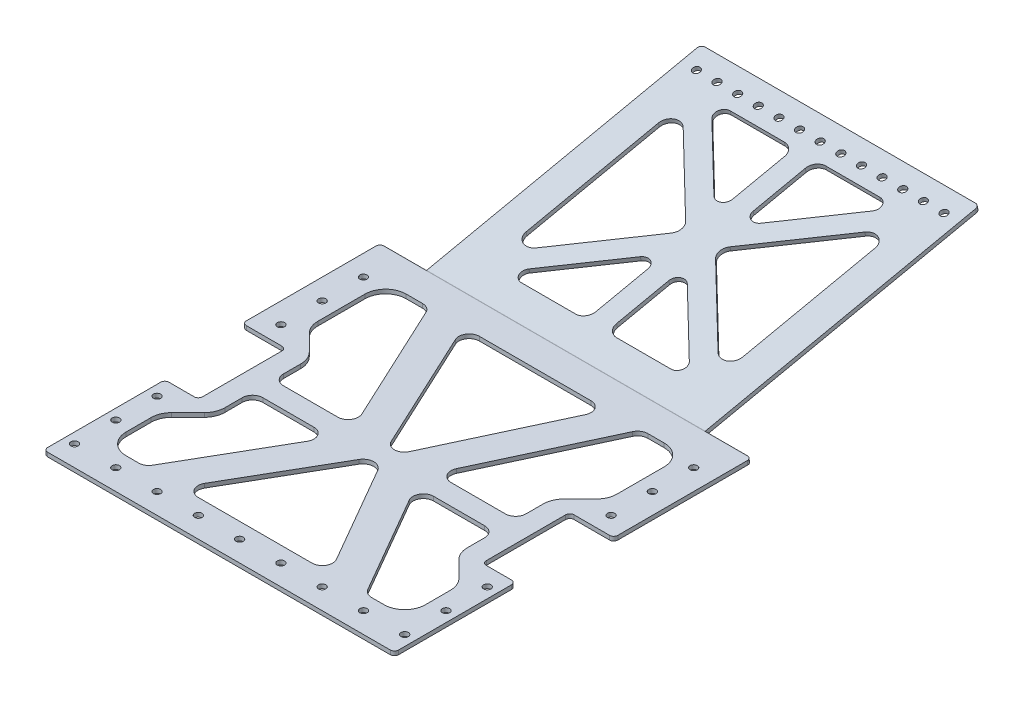
from build123d import *

# Parameters (mm, degrees)
BASE_FLANGE1_DEPTH     = 2.54
SKETCHED_START         = -114.3
SKETCHED_BEND1_DEPTH   = 228.6
SKETCHED_BEND1_2_DEPTH = 28.575
SKETCHED_START_2       = 85.725
SKETCHED_BEND1_3_DEPTH = 28.575
SKETCHED_START_3       = -85.725
SKETCHED_BEND1_4_DEPTH = 171.45
SKETCHED_BEND1_5_DEPTH = 228.6
F_8_CLEARANCE_HOLE1_D  = 4.4958
F_8_CLEARANCE_HOLE2_D  = 4.4958
FILLET1_START          = -2.54
FILLET1_DEPTH          = 2.54
FILLET1_START_2        = -4
FILLET1_2_DEPTH        = 5
FILLET1_START_3        = -26
FILLET1_3_DEPTH        = 5
FILLET1_START_4        = -48
FILLET1_4_DEPTH        = 5
CUT_EXTRUDE1_DEPTH     = 402.134031528
CUT_EXTRUDE2_DEPTH     = 399.66822503


with BuildPart() as part:
    # Base-Flange1: sheet metal written as solids
    # Sketch1 → Base-Flange1 (new body)
    with BuildSketch(Plane(origin=(0, 0, 0), x_dir=(1, 0, 0), z_dir=(0, 1, 0))):
        Polygon((-107.95, 0), (107.95, 0), (107.95, 74.6125), (87.3125, 74.6125), (87.3125, 128.5875), (114.3, 128.5875), (114.3, 213.519597452), (85.725, 213.519597452), (85.725, 386.335902568), (-85.725, 386.335902568), (-85.725, 213.519597452), (-114.3, 213.519597452), (-114.3, 128.5875), (-87.3125, 128.5875), (-87.3125, 74.6125), (-107.95, 74.6125), align=None)
    extrude(amount=-BASE_FLANGE1_DEPTH)

    # Sketched Bend1: read off the stored shape, not the designer's step
    # Sketched Bend1 outline → Sketched Bend1 (cut)
    with BuildSketch(Plane.YZ.offset(SKETCHED_START)):
        with BuildLine():
            Line((0, -386.335902568), (0, -225.603611808))
            Line((0, -225.603611808), (-2.468398429, -213.990710237))
            ThreePointArc((-2.468398429, -213.990710237), (-2.522050442, -213.651964754), (-2.54, -213.309466791))
            Line((-2.54, -213.309466791), (-2.54, -386.335902568))
            Line((-2.54, -386.335902568), (0, -386.335902568))
        make_face()
    extrude(amount=SKETCHED_BEND1_DEPTH, mode=Mode.SUBTRACT)

    # Sketched Bend1 2 outline → Sketched Bend1 2 (cut)
    with BuildSketch(Plane.YZ.offset(SKETCHED_START)):
        Polygon((0, -213.519597452), (0, -213.386886571), (-1.26265969, -213.519597452), align=None)
    extrude(amount=SKETCHED_BEND1_2_DEPTH, mode=Mode.SUBTRACT)

    # Sketched Bend1 3 outline → Sketched Bend1 3 (cut)
    with BuildSketch(Plane.YZ.offset(SKETCHED_START_2)):
        Polygon((0, -213.519597452), (0, -213.386886571), (-1.26265969, -213.519597452), align=None)
    extrude(amount=SKETCHED_BEND1_3_DEPTH, mode=Mode.SUBTRACT)

    # Sketched Bend1 4 outline → Sketched Bend1 4 (add)
    with BuildSketch(Plane.YZ.offset(SKETCHED_START_3)):
        with BuildLine():
            Line((35.902938054, -382.296929958), (0.016096477, -213.462614543))
            ThreePointArc((0.016096477, -213.462614543), (0.004035172, -213.386462457), (0, -213.309466791))
            Line((0, -213.309466791), (0, -225.603611808))
            Line((0, -225.603611808), (33.418443148, -382.825025653))
            Line((33.418443148, -382.825025653), (35.902938054, -382.296929958))
        make_face()
    extrude(amount=SKETCHED_BEND1_4_DEPTH)

    # Sketched Bend1 5 outline → Sketched Bend1 5 (add)
    with BuildSketch(Plane.YZ.offset(SKETCHED_START)):
        with BuildLine():
            Line((0, -213.386886571), (0.004035172, -213.386462457))
            ThreePointArc((0.004035172, -213.386462457), (0.001009485, -213.348017456), (0, -213.309466791))
            Line((0, -213.309466791), (0, -213.386886571))
        make_face()
        with BuildLine():
            Line((-2.522050442, -213.651964754), (-1.26265969, -213.519597452))
            Line((-1.26265969, -213.519597452), (-2.533255144, -213.519597452))
            ThreePointArc((-2.533255144, -213.519597452), (-2.52832367, -213.585837892), (-2.522050442, -213.651964754))
        make_face()
    extrude(amount=SKETCHED_BEND1_5_DEPTH)

    # #8 Clearance Hole1 (through all)
    with Locations(Plane(origin=(0, 0, 0), x_dir=(1, 0, 0), z_dir=(0, 1, 0))):
        with Locations((-101.6, 12.7), (-101.6, 38.1), (-101.6, 63.5), (-101.6, 139.7), (-101.6, 165.1), (-101.6, 190.5), (101.6, 190.5), (101.6, 165.1), (101.6, 139.7), (101.6, 63.5), (101.6, 38.1), (-76.2, 12.7), (-50.8, 12.7), (-25.4, 12.7), (0, 12.7), (25.4, 12.7), (50.8, 12.7), (76.2, 12.7), (101.6, 12.7)):
            Hole(F_8_CLEARANCE_HOLE1_D / 2)

    # #8 Clearance Hole2 (through all)
    with Locations(Plane(origin=(0, -43.39613296, -9.224132812), x_dir=(1, 0, 0), z_dir=(0, 0.9781476007338055, 0.20791169081775976))):
        with Locations((-76.2, 368.80397692), (-63.5, 368.80397692), (-50.8, 368.80397692), (-38.1, 368.80397692), (-25.4, 368.80397692), (-12.7, 368.80397692), (0, 368.80397692), (12.7, 368.80397692), (25.4, 368.80397692), (38.1, 368.80397692), (50.8, 368.80397692), (63.5, 368.80397692), (76.2, 368.80397692)):
            Hole(F_8_CLEARANCE_HOLE2_D / 2)

    # Fillet1: read off the stored shape, not the designer's step
    # Fillet1 outline → Fillet1 (add)
    with BuildSketch(Plane(origin=(0, 0, 0), x_dir=(1, 0, 0), z_dir=(0, 1, 0)).offset(FILLET1_START)):
        with BuildLine():
            Line((87.3125, 128.5875), (87.3125, 126.0475))
            ThreePointArc((87.3125, 126.0475), (88.056448776, 127.843551224), (89.8525, 128.5875))
            Line((89.8525, 128.5875), (87.3125, 128.5875))
        make_face()
        with BuildLine():
            Line((87.3125, 74.6125), (89.8525, 74.6125))
            ThreePointArc((89.8525, 74.6125), (88.056448776, 75.356448776), (87.3125, 77.1525))
            Line((87.3125, 77.1525), (87.3125, 74.6125))
        make_face()
        with BuildLine():
            ThreePointArc((-89.8525, 128.5875), (-88.056448776, 127.843551224), (-87.3125, 126.0475))
            Line((-87.3125, 126.0475), (-87.3125, 128.5875))
            Line((-87.3125, 128.5875), (-89.8525, 128.5875))
        make_face()
        with BuildLine():
            ThreePointArc((-87.3125, 77.1525), (-88.056448776, 75.356448776), (-89.8525, 74.6125))
            Line((-89.8525, 74.6125), (-87.3125, 74.6125))
            Line((-87.3125, 74.6125), (-87.3125, 77.1525))
        make_face()
    extrude(amount=FILLET1_DEPTH)

    # Fillet1 2 outline → Fillet1 2 (cut)
    with BuildSketch(Plane(origin=(0, 0, 0), x_dir=(1, 0, 0), z_dir=(0, 1, 0)).offset(FILLET1_START_2)):
        with BuildLine():
            ThreePointArc((114.3, 131.1275), (113.556051224, 129.331448776), (111.76, 128.5875))
            Line((111.76, 128.5875), (114.3, 128.5875))
            Line((114.3, 128.5875), (114.3, 131.1275))
        make_face()
        with BuildLine():
            Line((-114.3, 128.5875), (-111.76, 128.5875))
            ThreePointArc((-111.76, 128.5875), (-113.556051224, 129.331448776), (-114.3, 131.1275))
            Line((-114.3, 131.1275), (-114.3, 128.5875))
        make_face()
        with BuildLine():
            Line((-107.95, 74.6125), (-107.95, 72.0725))
            ThreePointArc((-107.95, 72.0725), (-107.206051224, 73.868551224), (-105.41, 74.6125))
            Line((-105.41, 74.6125), (-107.95, 74.6125))
        make_face()
        with BuildLine():
            Line((-107.95, 0), (-105.41, 0))
            ThreePointArc((-105.41, 0), (-107.206051224, 0.743948776), (-107.95, 2.54))
            Line((-107.95, 2.54), (-107.95, 0))
        make_face()
        with BuildLine():
            Line((107.95, 0), (107.95, 2.54))
            ThreePointArc((107.95, 2.54), (107.206051224, 0.743948776), (105.41, 0))
            Line((105.41, 0), (107.95, 0))
        make_face()
        with BuildLine():
            ThreePointArc((105.41, 74.6125), (107.206051224, 73.868551224), (107.95, 72.0725))
            Line((107.95, 72.0725), (107.95, 74.6125))
            Line((107.95, 74.6125), (105.41, 74.6125))
        make_face()
    extrude(amount=FILLET1_2_DEPTH, mode=Mode.SUBTRACT)

    # Fillet1 3 outline → Fillet1 3 (cut)
    with BuildSketch(Plane(origin=(0, 0, 0), x_dir=(1, 0, 0), z_dir=(0, 0.9945218953682732, 0.10452846326765503)).offset(FILLET1_START_3)):
        with BuildLine():
            Line((-114.3, 212.217930879), (-114.3, 209.677930879))
            ThreePointArc((-114.3, 209.677930879), (-113.556051224, 211.473982103), (-111.76, 212.217930879))
            Line((-111.76, 212.217930879), (-114.3, 212.217930879))
        make_face()
        with BuildLine():
            Line((114.3, 212.217930879), (111.76, 212.217930879))
            ThreePointArc((111.76, 212.217930879), (113.556051224, 211.473982103), (114.3, 209.677930879))
            Line((114.3, 209.677930879), (114.3, 212.217930879))
        make_face()
    extrude(amount=FILLET1_3_DEPTH, mode=Mode.SUBTRACT)

    # Fillet1 4 outline → Fillet1 4 (cut)
    with BuildSketch(Plane(origin=(0, 0, 0), x_dir=(1, 0, 0), z_dir=(0, 0.9781476007338056, 0.20791169081775993)).offset(FILLET1_START_4)):
        with BuildLine():
            ThreePointArc((-85.725, 378.867465362), (-84.981051224, 380.663516587), (-83.185, 381.407465362))
            Line((-83.185, 381.407465362), (-85.725, 381.407465362))
            Line((-85.725, 381.407465362), (-85.725, 378.867465362))
        make_face()
        with BuildLine():
            ThreePointArc((83.185, 381.407465362), (84.981051224, 380.663516587), (85.725, 378.867465362))
            Line((85.725, 378.867465362), (85.725, 381.407465362))
            Line((85.725, 381.407465362), (83.185, 381.407465362))
        make_face()
    extrude(amount=FILLET1_4_DEPTH, mode=Mode.SUBTRACT)

    # Sketch12 → Cut-Extrude1 (cut, through all)
    with BuildSketch(Plane(origin=(0, 0, 0), x_dir=(1, 0, 0), z_dir=(0, 1, 0))):
        with BuildLine():
            Line((-36.854432116, 95.25), (-68.2625, 95.25))
            ThreePointArc((-68.2625, 95.25), (-72.752628061, 93.390128061), (-74.6125, 88.9))
            Line((-74.6125, 88.9), (-74.6125, 78.285512242))
            ThreePointArc((-74.6125, 78.285512242), (-75.579229937, 73.425432651), (-78.332243879, 69.305256121))
            Line((-78.332243879, 69.305256121), (-88.355256121, 59.282243879))
            ThreePointArc((-88.355256121, 59.282243879), (-91.108270063, 55.162067349), (-92.075, 50.301987758))
            Line((-92.075, 50.301987758), (-92.075, 34.925))
            ThreePointArc((-92.075, 34.925), (-88.355256121, 25.944743879), (-79.375, 22.225))
            Line((-79.375, 22.225), (-71.683087105, 22.225))
            ThreePointArc((-71.683087105, 22.225), (-68.508087105, 23.075738686), (-66.183825791, 25.4))
            Line((-66.183825791, 25.4), (-31.355170802, 85.725))
            ThreePointArc((-31.355170802, 85.725), (-31.355170802, 92.075), (-36.854432116, 95.25))
        make_face()
        with BuildLine():
            Line((92.075, 34.925), (92.075, 50.301987758))
            ThreePointArc((92.075, 50.301987758), (91.108270063, 55.162067349), (88.355256121, 59.282243879))
            Line((88.355256121, 59.282243879), (78.332243879, 69.305256121))
            ThreePointArc((78.332243879, 69.305256121), (75.579229937, 73.425432651), (74.6125, 78.285512242))
            Line((74.6125, 78.285512242), (74.6125, 88.9))
            ThreePointArc((74.6125, 88.9), (72.752628061, 93.390128061), (68.2625, 95.25))
            Line((68.2625, 95.25), (36.854432116, 95.25))
            ThreePointArc((36.854432116, 95.25), (31.355170802, 92.075), (31.355170802, 85.725))
            Line((31.355170802, 85.725), (66.183825791, 25.4))
            ThreePointArc((66.183825791, 25.4), (68.508087105, 23.075738686), (71.683087105, 22.225))
            Line((71.683087105, 22.225), (79.375, 22.225))
            ThreePointArc((79.375, 22.225), (88.355256121, 25.944743879), (92.075, 34.925))
        make_face()
        with BuildLine():
            Line((-88.355256121, 143.917756121), (-78.332243879, 133.894743879))
            ThreePointArc((-78.332243879, 133.894743879), (-75.579229937, 129.774567349), (-74.6125, 124.914487758))
            Line((-74.6125, 124.914487758), (-74.6125, 114.3))
            ThreePointArc((-74.6125, 114.3), (-72.752628061, 109.809871939), (-68.2625, 107.95))
            Line((-68.2625, 107.95), (-34.847251869, 107.95))
            ThreePointArc((-34.847251869, 107.95), (-29.491716188, 110.888147487), (-29.092197421, 116.983625962))
            Line((-29.092197421, 116.983625962), (-63.576564922, 190.935590716))
            ThreePointArc((-63.576564922, 190.935590716), (-65.919766856, 193.607500435), (-69.331619369, 194.601964754))
            Line((-69.331619369, 194.601964754), (-79.375, 194.601964754))
            ThreePointArc((-79.375, 194.601964754), (-88.355256121, 190.882220875), (-92.075, 181.901964754))
            Line((-92.075, 181.901964754), (-92.075, 152.898012242))
            ThreePointArc((-92.075, 152.898012242), (-91.108270063, 148.037932651), (-88.355256121, 143.917756121))
        make_face()
        with BuildLine():
            Line((92.075, 152.898012242), (92.075, 181.901964754))
            ThreePointArc((92.075, 181.901964754), (88.355256121, 190.882220875), (79.375, 194.601964754))
            Line((79.375, 194.601964754), (69.331619369, 194.601964754))
            ThreePointArc((69.331619369, 194.601964754), (65.919766856, 193.607500435), (63.576564922, 190.935590716))
            Line((63.576564922, 190.935590716), (29.092197421, 116.983625962))
            ThreePointArc((29.092197421, 116.983625962), (29.491716188, 110.888147487), (34.847251869, 107.95))
            Line((34.847251869, 107.95), (68.2625, 107.95))
            ThreePointArc((68.2625, 107.95), (72.752628061, 109.809871939), (74.6125, 114.3))
            Line((74.6125, 114.3), (74.6125, 124.914487758))
            ThreePointArc((74.6125, 124.914487758), (75.579229937, 129.774567349), (78.332243879, 133.894743879))
            Line((78.332243879, 133.894743879), (88.355256121, 143.917756121))
            ThreePointArc((88.355256121, 143.917756121), (91.108270063, 148.037932651), (92.075, 152.898012242))
        make_face()
        with BuildLine():
            Line((40.520606325, 31.75), (5.788296347, 91.908125546))
            ThreePointArc((5.788296347, 91.908125546), (0, 95.25), (-5.788296347, 91.908125546))
            Line((-5.788296347, 91.908125546), (-40.520606325, 31.75))
            ThreePointArc((-40.520606325, 31.75), (-40.520606325, 25.4), (-35.021345011, 22.225))
            Line((-35.021345011, 22.225), (35.021345011, 22.225))
            ThreePointArc((35.021345011, 22.225), (40.520606325, 25.4), (40.520606325, 31.75))
        make_face()
        with BuildLine():
            Line((40.05442489, 185.568338792), (5.491874254, 111.448709764))
            ThreePointArc((5.491874254, 111.448709764), (0, 107.95), (-5.491874254, 111.448709764))
            Line((-5.491874254, 111.448709764), (-40.05442489, 185.568338792))
            ThreePointArc((-40.05442489, 185.568338792), (-39.654906123, 191.663817267), (-34.299370442, 194.601964754))
            Line((-34.299370442, 194.601964754), (34.299370442, 194.601964754))
            ThreePointArc((34.299370442, 194.601964754), (39.654906123, 191.663817267), (40.05442489, 185.568338792))
        make_face()
    extrude(amount=-CUT_EXTRUDE1_DEPTH, mode=Mode.SUBTRACT)

    # Sketch13 → Cut-Extrude2 (cut, through all)
    with BuildSketch(Plane(origin=(0, -45.880627866, -9.752228506), x_dir=(1, 0, 0), z_dir=(0, -0.9781476007338056, -0.2079116908177598))):
        with BuildLine():
            Line((46.012046137, -227.851290907), (12.7, -227.851290907))
            ThreePointArc((12.7, -227.851290907), (8.209871939, -229.711162847), (6.35, -234.201290907))
            Line((6.35, -234.201290907), (6.35, -267.010240789))
            ThreePointArc((6.35, -267.010240789), (9.27401033, -271.403572325), (14.455558838, -270.402196545))
            Line((14.455558838, -270.402196545), (49.355104976, -236.005746663))
            ThreePointArc((49.355104976, -236.005746663), (50.418609171, -230.807244899), (46.012046137, -227.851290907))
        make_face()
        with BuildLine():
            Line((66.675, -251.941278954), (66.675, -335.188988873))
            ThreePointArc((66.675, -335.188988873), (62.77631956, -341.046764254), (55.867588215, -339.711596548))
            Line((55.867588215, -339.711596548), (13.634926078, -298.087741588))
            ThreePointArc((13.634926078, -298.087741588), (11.742337863, -293.565133913), (13.634926078, -289.042526238))
            Line((13.634926078, -289.042526238), (55.867588215, -247.418671279))
            ThreePointArc((55.867588215, -247.418671279), (62.77631956, -246.083503573), (66.675, -251.941278954))
        make_face()
        with BuildLine():
            Line((46.012046137, -359.27897692), (12.7, -359.27897692))
            ThreePointArc((12.7, -359.27897692), (8.209871939, -357.41910498), (6.35, -352.92897692))
            Line((6.35, -352.92897692), (6.35, -320.120027038))
            ThreePointArc((6.35, -320.120027038), (9.27401033, -315.726695502), (14.455558838, -316.728071282))
            Line((14.455558838, -316.728071282), (49.355104976, -351.124521163))
            ThreePointArc((49.355104976, -351.124521163), (50.418609171, -356.323022928), (46.012046137, -359.27897692))
        make_face()
        with BuildLine():
            Line((-6.35, -234.201290907), (-6.35, -267.010240789))
            ThreePointArc((-6.35, -267.010240789), (-9.27401033, -271.403572325), (-14.455558838, -270.402196545))
            Line((-14.455558838, -270.402196545), (-49.355104976, -236.005746663))
            ThreePointArc((-49.355104976, -236.005746663), (-50.418609171, -230.807244899), (-46.012046137, -227.851290907))
            Line((-46.012046137, -227.851290907), (-12.7, -227.851290907))
            ThreePointArc((-12.7, -227.851290907), (-8.209871939, -229.711162847), (-6.35, -234.201290907))
        make_face()
        with BuildLine():
            Line((-55.867588215, -247.418671279), (-13.634926078, -289.042526238))
            ThreePointArc((-13.634926078, -289.042526238), (-11.742337863, -293.565133913), (-13.634926078, -298.087741588))
            Line((-13.634926078, -298.087741588), (-55.867588215, -339.711596548))
            ThreePointArc((-55.867588215, -339.711596548), (-62.77631956, -341.046764254), (-66.675, -335.188988873))
            Line((-66.675, -335.188988873), (-66.675, -251.941278954))
            ThreePointArc((-66.675, -251.941278954), (-62.77631956, -246.083503573), (-55.867588215, -247.418671279))
        make_face()
        with BuildLine():
            Line((-14.455558838, -316.728071282), (-49.355104976, -351.124521163))
            ThreePointArc((-49.355104976, -351.124521163), (-50.418609171, -356.323022928), (-46.012046137, -359.27897692))
            Line((-46.012046137, -359.27897692), (-12.7, -359.27897692))
            ThreePointArc((-12.7, -359.27897692), (-8.209871939, -357.41910498), (-6.35, -352.92897692))
            Line((-6.35, -352.92897692), (-6.35, -320.120027038))
            ThreePointArc((-6.35, -320.120027038), (-9.27401033, -315.726695502), (-14.455558838, -316.728071282))
        make_face()
    extrude(amount=-CUT_EXTRUDE2_DEPTH, mode=Mode.SUBTRACT)


solid = part.part
